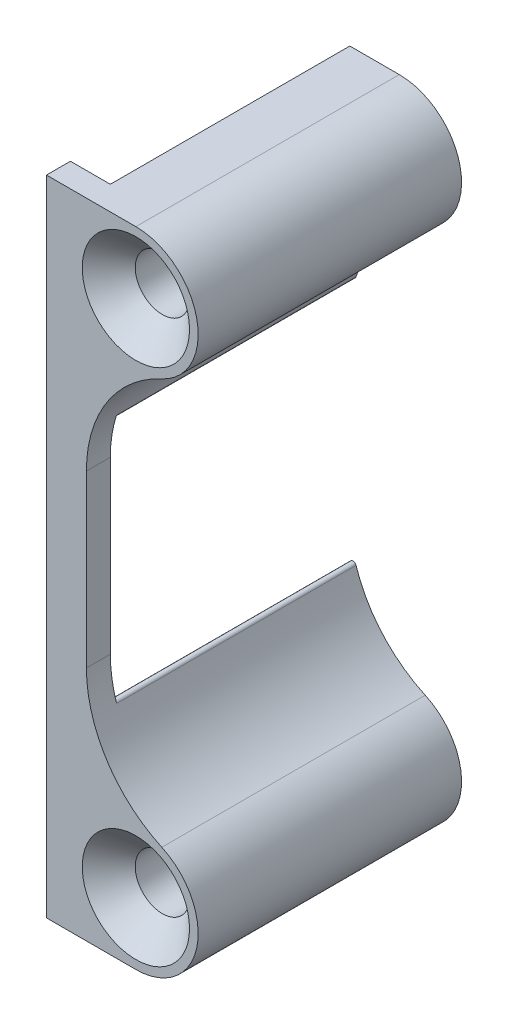
from build123d import *

# Parameters (mm, degrees)
SKETCH_1_W                  = 155
SKETCH_1_H                  = 40.5
EXTRUDE_1_DEPTH             = 1.5
EXTRUDE_2_DEPTH             = 1.5
FILLET_2_R                  = 8
CUT_EXTRUDE_1_DEPTH         = 167.992514924
SKETCH_5_W                  = 152.3
SKETCH_5_H                  = 40.3
CUT_EXTRUDE_2_DEPTH         = 167.871267749
EXTRUDE_3_DEPTH             = 15
FILLET_START                = -16
FILLET_3_DEPTH              = 16
HOLE_WIZARD_M31_D           = 3.4
HOLE_WIZARD_M31_CSINK_D     = 6.72
HOLE_WIZARD_M31_CSINK_ANGLE = 90


with BuildPart() as part:
    # Эскиз1 → Бобышка-Вытянуть1 (new body)
    with BuildSketch(Plane.XY):
        with Locations((77.5, 20.25)):
            Rectangle(SKETCH_1_W, SKETCH_1_H)
    extrude(amount=EXTRUDE_1_DEPTH)

    # Эскиз2 → Бобышка-Вытянуть2 (add)
    with BuildSketch(Plane(origin=(0, 0, 0), x_dir=(-1, 0, 0), z_dir=(0, 0, -1))):
        with BuildLine():
            Line((-158, 0), (-155, 0))
            Line((-155, 0), (-155, 8))
            Line((-155, 8), (-158, 8))
            ThreePointArc((-158, 8), (-162, 4), (-158, 0))
        make_face()
        with BuildLine():
            Line((-155, 32.5), (-155, 40.5))
            Line((-155, 40.5), (-158, 40.5))
            ThreePointArc((-158, 40.5), (-162, 36.5), (-158, 32.5))
            Line((-158, 32.5), (-155, 32.5))
        make_face()
    extrude(amount=-EXTRUDE_2_DEPTH)

    # Скругление2
    fillet_2_edges = [part.edges().sort_by_distance(p)[0] for p in [
        (155, 8, 0.75),
        (155, 32.5, 0.75),
    ]]
    fillet(fillet_2_edges, radius=FILLET_2_R)

    # Эскиз3 → Вырез-Вытянуть1 (cut, through all)
    with BuildSketch(Plane.XY.offset(1.5)):
        with BuildLine():
            Line((155, 14.908712115), (155, 25.591287885))
            ThreePointArc((155, 25.591287885), (156.266996708, 29.911781684), (159.666666667, 32.863762628))
            ThreePointArc((159.666666667, 32.863762628), (161.908001374, 37.352950911), (158, 40.5))
            Line((158, 40.5), (0, 40.5))
            Line((0, 40.5), (0, 0))
            Line((0, 0), (158, 0))
            ThreePointArc((158, 0), (161.908001374, 3.147049089), (159.666666667, 7.636237372))
            ThreePointArc((159.666666667, 7.636237372), (156.266996708, 10.588218316), (155, 14.908712115))
        make_face()
        with BuildLine():
            Line((154.9, 14.908712115), (154.9, 25.591287885))
            ThreePointArc((154.9, 25.591287885), (156.182834167, 29.965787857), (159.625, 32.954668563))
            ThreePointArc((159.625, 32.954668563), (161.81030134, 37.331627138), (158, 40.4))
            Line((158, 40.4), (0.1, 40.4))
            Line((0.1, 40.4), (0.1, 0.1))
            Line((0.1, 0.1), (158, 0.1))
            ThreePointArc((158, 0.1), (161.81030134, 3.168372862), (159.625, 7.545331437))
            ThreePointArc((159.625, 7.545331437), (156.182834167, 10.534212143), (154.9, 14.908712115))
        make_face(mode=Mode.SUBTRACT)
    extrude(amount=-CUT_EXTRUDE_1_DEPTH, mode=Mode.SUBTRACT)

    # Эскиз5 → Вырез-Вытянуть2 (cut, through all)
    with BuildSketch(Plane(origin=(0, 0, 0), x_dir=(-1, 0, 0), z_dir=(0, 0, -1))):
        with Locations((-76.25, 20.25)):
            Rectangle(SKETCH_5_W, SKETCH_5_H)
    extrude(amount=-CUT_EXTRUDE_2_DEPTH, mode=Mode.SUBTRACT)

    # Эскиз6 → Бобышка-Вытянуть3 (add)
    with BuildSketch(Plane(origin=(0, 0, 0), x_dir=(-1, 0, 0), z_dir=(0, 0, -1))):
        with BuildLine():
            Line((-154.9, 40.4), (-154.9, 25.591287885))
            ThreePointArc((-154.9, 25.591287885), (-156.182834167, 29.965787857), (-159.625, 32.954668563))
            ThreePointArc((-159.625, 32.954668563), (-161.81030134, 37.331627138), (-158, 40.4))
            Line((-158, 40.4), (-154.9, 40.4))
        make_face()
        with BuildLine():
            Line((-154.9, 0.1), (-154.9, 14.908712115))
            ThreePointArc((-154.9, 14.908712115), (-156.182834167, 10.534212143), (-159.625, 7.545331437))
            ThreePointArc((-159.625, 7.545331437), (-161.81030134, 3.168372862), (-158, 0.1))
            Line((-158, 0.1), (-154.9, 0.1))
        make_face()
    extrude(amount=EXTRUDE_3_DEPTH)

    # Скругление3: read off the stored shape, not the designer's step
    # Скругление3 outline → Скругление3 (cut)
    with BuildSketch(Plane.XY.offset(FILLET_START)):
        with BuildLine():
            ThreePointArc((154.9, 12.363127702), (155.068953979, 12.56070337), (155.290361446, 12.424467086))
            ThreePointArc((155.290361446, 12.424467086), (154.998185447, 13.651348263), (154.9, 14.908712115))
            Line((154.9, 14.908712115), (154.9, 12.363127702))
        make_face()
        with BuildLine():
            ThreePointArc((155.290361446, 28.075532914), (155.068953979, 27.93929663), (154.9, 28.136872298))
            Line((154.9, 28.136872298), (154.9, 25.591287885))
            ThreePointArc((154.9, 25.591287885), (154.998185447, 26.848651737), (155.290361446, 28.075532914))
        make_face()
    extrude(amount=FILLET_3_DEPTH, mode=Mode.SUBTRACT)

    # Зенковка для  винта с потайной головкой с внутренним шестигранником M31 (through all)
    with Locations(Plane.XY.offset(1.5)):
        with Locations((158, 36.5), (158, 4)):
            CounterSinkHole(HOLE_WIZARD_M31_D / 2, HOLE_WIZARD_M31_CSINK_D / 2, counter_sink_angle=HOLE_WIZARD_M31_CSINK_ANGLE)


solid = part.part
